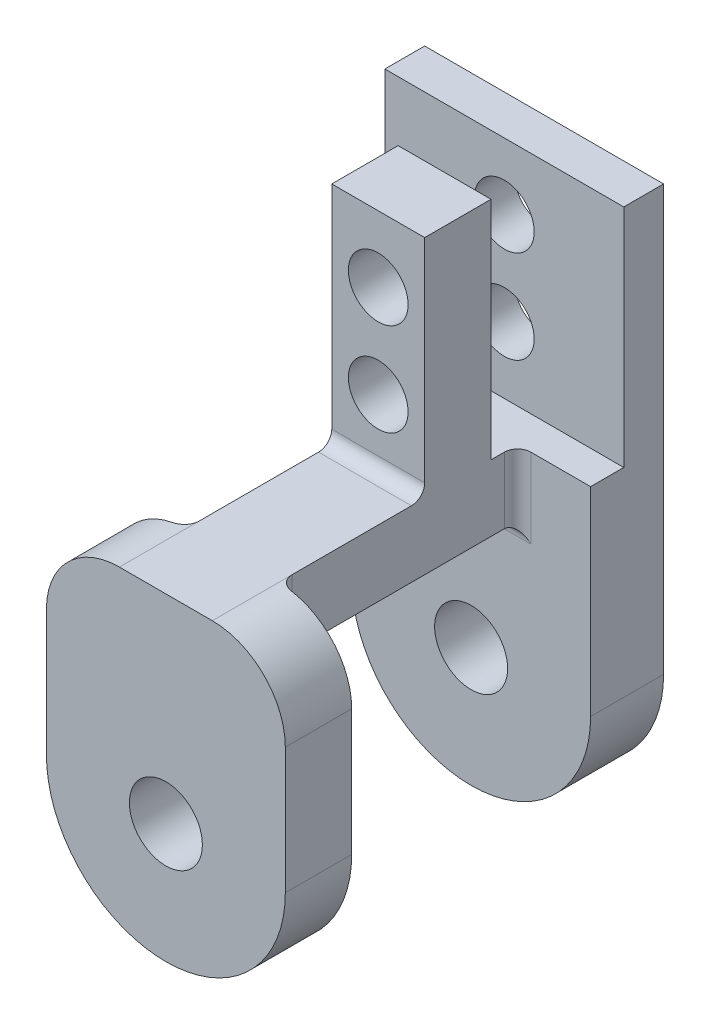
from build123d import *

# Parameters (mm, degrees)
ESQUISSE1_W             = 20
ESQUISSE1_H             = 17
ESQUISSE1_R             = 2.1
BOSS_EXTRU_1_DEPTH      = 5
ESQUISSE2_W             = 18
ESQUISSE2_H             = 3
BOSS_EXTRU_3_DEPTH      = 24
ESQUISSE5_W             = 6.5
ESQUISSE5_H             = 17
ENL_V_MAT_EXTRU_3_DEPTH = 18
ESQUISSE10_W            = 7
ESQUISSE10_H            = 3
BOSS_EXTRU_6_DEPTH      = 10
ESQUISSE11_W            = 5.5
ESQUISSE11_H            = 2.5
ESQUISSE11_W_2          = 7
ESQUISSE11_H_2          = 0.5
BOSS_EXTRU_7_DEPTH      = 17
ESQUISSE12_W            = 18
ESQUISSE12_H            = 2.5
BOSS_EXTRU_8_DEPTH      = 24
CONG_3_R                = 9
ESQUISSE20_R            = 2.25
ENL_V_MAT_EXTRU_7_DEPTH = 18
ESQUISSE22_W            = 7
ESQUISSE22_H            = 5
BOSS_EXTRU_9_DEPTH      = 23
ESQUISSE27_W            = 5.5
ESQUISSE27_H            = 5
ESQUISSE27_W_2          = 7
BOSS_EXTRU_10_DEPTH     = 24
CONG_4_R                = 9
ESQUISSE28_R            = 2.75
ENL_V_MAT_EXTRU_8_DEPTH = 44
CONG_5_R                = 1
CONG_6_R                = 5.5


with BuildPart() as part:
    # Esquisse1 → Boss.-Extru.1 (new body)
    with BuildSketch(Plane.XY):
        with Locations((10, 8.5)):
            Rectangle(ESQUISSE1_W, ESQUISSE1_H)
        with Locations((10, 5)):
            Circle(ESQUISSE1_R, mode=Mode.SUBTRACT)
        with Locations((10, 12)):
            Circle(ESQUISSE1_R, mode=Mode.SUBTRACT)
    extrude(amount=BOSS_EXTRU_1_DEPTH)

    # Esquisse5 → Enlèv. mat.-Extru.3 (cut)
    with BuildSketch(Plane.XY.offset(5)):
        with Locations((16.75, 8.5)):
            Rectangle(ESQUISSE5_W, ESQUISSE5_H)
        with Locations((3.25, 8.5)):
            Rectangle(ESQUISSE5_W, ESQUISSE5_H)
    extrude(amount=-ENL_V_MAT_EXTRU_3_DEPTH, mode=Mode.SUBTRACT)



with BuildPart() as body_2:
    # Esquisse2 → Boss.-Extru.3 (new body)
    with BuildSketch(Plane.XZ):
        with Locations((10, -3.5)):
            Rectangle(ESQUISSE2_W, ESQUISSE2_H)
    extrude(amount=BOSS_EXTRU_3_DEPTH)


with BuildPart() as part_1:
    add(part.part)

    add(body_2.part)  # Boss.-Extru.6 merges body 2
    # Esquisse10 → Boss.-Extru.6 (add)
    with BuildSketch(Plane.XY.offset(5)):
        with Locations((10, -1.5)):
            Rectangle(ESQUISSE10_W, ESQUISSE10_H)
    extrude(amount=-BOSS_EXTRU_6_DEPTH)

    # Esquisse11 → Boss.-Extru.7 (add)
    with BuildSketch(Plane(origin=(0, 0, 0), x_dir=(1, 0, 0), z_dir=(0, 1, 0))):
        with Locations((3.75, 6.25)):
            Rectangle(ESQUISSE11_W, ESQUISSE11_H)
        with Locations((10, 6.25)):
            Rectangle(ESQUISSE11_W_2, ESQUISSE11_H)
        with Locations((16.25, 6.25)):
            Rectangle(ESQUISSE11_W, ESQUISSE11_H)
        with Locations((3.75, 4.75)):
            Rectangle(ESQUISSE11_W, ESQUISSE11_H_2)
        with Locations((10, 4.75)):
            Rectangle(ESQUISSE11_W_2, ESQUISSE11_H_2)
        with Locations((16.25, 4.75)):
            Rectangle(ESQUISSE11_W, ESQUISSE11_H_2)
    extrude(amount=BOSS_EXTRU_7_DEPTH)

    # Esquisse12 → Boss.-Extru.8 (add)
    with BuildSketch(Plane.XZ):
        with Locations((10, -6.25)):
            Rectangle(ESQUISSE12_W, ESQUISSE12_H)
    extrude(amount=BOSS_EXTRU_8_DEPTH)

    # Congé3
    cong_3_edges = [part_1.edges().sort_by_distance(p)[0] for p in [
        (19, -24, -4.75),
        (1, -24, -4.75),
    ]]
    fillet(cong_3_edges, radius=CONG_3_R - 0.0001)  # a hair under: the kernel refuses the full size

    # Esquisse20 → Enlèv. mat.-Extru.7 (cut)
    with BuildSketch(Plane.XY.offset(5)):
        with Locations((10, 5)):
            Circle(ESQUISSE20_R)
        with Locations((10, 12)):
            Circle(ESQUISSE20_R)
    extrude(amount=-ENL_V_MAT_EXTRU_7_DEPTH, mode=Mode.SUBTRACT)

    # Esquisse22 → Boss.-Extru.9 (add)
    with BuildSketch(Plane.XY.offset(-2)):
        with Locations((10, -2.5)):
            Rectangle(ESQUISSE22_W, ESQUISSE22_H)
    extrude(amount=BOSS_EXTRU_9_DEPTH)

    # Esquisse27 → Boss.-Extru.10 (add)
    with BuildSketch(Plane(origin=(0, 0, 0), x_dir=(1, 0, 0), z_dir=(0, 1, 0))):
        with Locations((3.75, -18.5)):
            Rectangle(ESQUISSE27_W, ESQUISSE27_H)
        with Locations((16.25, -18.5)):
            Rectangle(ESQUISSE27_W, ESQUISSE27_H)
        with Locations((10, -18.5)):
            Rectangle(ESQUISSE27_W_2, ESQUISSE27_H)
    extrude(amount=-BOSS_EXTRU_10_DEPTH)

    # Congé4
    cong_4_edges = [part_1.edges().sort_by_distance(p)[0] for p in [
        (1, -24, 18.5),
        (19, -24, 18.5),
    ]]
    fillet(cong_4_edges, radius=CONG_4_R - 0.0001)  # a hair under: the kernel refuses the full size

    # Esquisse28 → Enlèv. mat.-Extru.8 (cut)
    with BuildSketch(Plane.XY.offset(21)):
        with Locations((10, -15)):
            Circle(ESQUISSE28_R)
    extrude(amount=-ENL_V_MAT_EXTRU_8_DEPTH, mode=Mode.SUBTRACT)

    # Congé5
    cong_5_edges = [part_1.edges().sort_by_distance(p)[0] for p in [
        (10, 0, 5),
        (10, -5, -2),
        (10, -5, 16),
        (6.5, -2.5, 16),
        (13.5, -2.5, 16),
        (6.5, -2.5, -2),
        (13.5, -2.5, -2),
    ]]
    fillet(cong_5_edges, radius=CONG_5_R)

    # Congé6
    cong_6_edges = [part_1.edges().sort_by_distance(p)[0] for p in [
        (1, 0, 18.5),
        (19, 0, 18.5),
    ]]
    fillet(cong_6_edges, radius=CONG_6_R - 0.0001)  # a hair under: the kernel refuses the full size


solid = part_1.part
